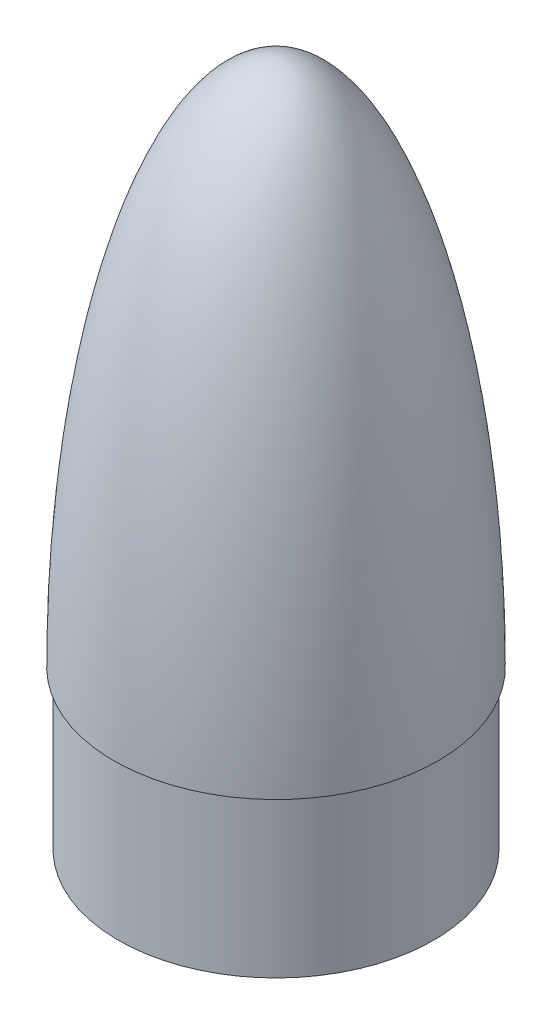
from build123d import *

# Parameters (mm, degrees)
SKETCH2_R           = 76.2
BOSS_EXTRUDE1_DEPTH = 76.2
SKETCH4_R           = 17.78
CUT_EXTRUDE1_DEPTH  = 96.52
CUT_EXTRUDE2_START  = 106.68
SKETCH5_R           = 8.255
CUT_EXTRUDE2_DEPTH  = 119.38
CUT_EXTRUDE3_START  = -25.4
SKETCH19_R          = 15.24
CUT_EXTRUDE3_DEPTH  = 101.6
SKETCH21_R          = 2.54
CUT_EXTRUDE4_DEPTH  = 6.35
SKETCH22_R          = 3
CUT_EXTRUDE5_DEPTH  = 12.7


with BuildPart() as part:
    # Sketch1 → Revolve1 (revolve)
    with BuildSketch(Plane.XY):
        with BuildLine():
            Line((78.359, 0), (0, 0))
            Line((0, 0), (0, 254))
            add(Edge.make_bspline(
                [(78.359, 0), (78.359, 0.547287489), (78.357845602, 1.649563618), (78.352650776, 3.586349875), (78.338796346, 5.988934597), (78.318010672, 8.352211569), (78.29028895, 10.745600888), (78.246958697, 13.731411826), (78.181061307, 17.311703382), (78.08386626, 21.490442467), (77.944822085, 26.264117007), (77.777683186, 31.037557631), (77.58229134, 35.809557456), (77.358460439, 40.580511863), (77.042853487, 46.542286246), (76.679080298, 52.501436144), (76.266448568, 58.457359127), (75.804102806, 64.409607399), (75.404015228, 69.168949637), (74.865626928, 75.114798701), (74.157385744, 82.243973993), (73.238266918, 90.551730955), (72.055740597, 100.030771811), (70.735528943, 109.491671534), (69.270929118, 118.931305028), (67.249996919, 130.699881306), (64.501732948, 144.763840427), (61.308555538, 158.735984092), (57.591049496, 172.577213574), (53.383025938, 186.275905479), (49.238746312, 198.044837449), (44.48323743, 209.587335711), (38.942884235, 220.71924179), (34.256173135, 228.693595393), (29.818710248, 235.095423042), (25.624249732, 240.182852143), (21.978892835, 243.926180276), (18.570150197, 246.859542723), (15.474349081, 249.076247661), (12.563405711, 250.785701438), (9.772327363, 252.083533871), (7.063069709, 253.028642362), (4.275373805, 253.686778481), (2.188006886, 253.939891173), (0.767171586, 253.999916555), (0, 254)],
                knots=[0.083290168, 0.083290168, 0.083290168, 0.083290168, 0.083290168, 0.091119674, 0.09894918, 0.106778686, 0.114608192, 0.122437698, 0.130267203, 0.145926215, 0.161585227, 0.177244239, 0.192903251, 0.208562263, 0.224221275, 0.239880287, 0.27119831, 0.286857322, 0.302516334, 0.318175346, 0.333834359, 0.365152383, 0.396470407, 0.42778843, 0.459106453, 0.490424474, 0.521742495, 0.584378539, 0.647014581, 0.678332609, 0.709650637, 0.772286631, 0.810589211, 0.841907031, 0.872607503, 0.893486158, 0.91262845, 0.928287274, 0.941044948, 0.952387223, 0.962498308, 0.97249612, 0.981348672, 0.989949856, 1, 1, 1, 1, 1], degree=4))
        make_face()
    revolve(axis=Axis((0, 254, 0), (0, -1, 0)))

    # Sketch2 → Boss-Extrude1 (add)
    with BuildSketch(Plane.XZ):
        Circle(SKETCH2_R)
    extrude(amount=BOSS_EXTRUDE1_DEPTH)

    # Sketch4 → Cut-Extrude1 (cut)
    with BuildSketch(Plane(origin=(0, 0, 0), x_dir=(1, 0, 0), z_dir=(0, 1, 0))):
        with Locations((48.26, 0)):
            Circle(SKETCH4_R)
        with Locations((0, -48.26)):
            Circle(SKETCH4_R)
        with Locations((-48.26, 0)):
            Circle(SKETCH4_R)
        with Locations((0, 48.26)):
            Circle(SKETCH4_R)
    extrude(amount=CUT_EXTRUDE1_DEPTH, mode=Mode.SUBTRACT)

    # Sketch5 → Cut-Extrude2 (cut)
    with BuildSketch(Plane(origin=(0, 0, 0), x_dir=(1, 0, 0), z_dir=(0, 1, 0)).offset(CUT_EXTRUDE2_START)):
        with Locations((20.32, 0)):
            Circle(SKETCH5_R)
        with Locations((10.16, -17.597636205)):
            Circle(SKETCH5_R)
        with Locations((-10.16, -17.597636205)):
            Circle(SKETCH5_R)
        with Locations((-20.32, 0)):
            Circle(SKETCH5_R)
        with Locations((-10.16, 17.597636205)):
            Circle(SKETCH5_R)
        with Locations((10.16, 17.597636205)):
            Circle(SKETCH5_R)
    extrude(amount=CUT_EXTRUDE2_DEPTH, mode=Mode.SUBTRACT)

    # Sketch6 → Cut-Revolve2 (revolve, cut)
    with BuildSketch(Plane.XY):
        Polygon((-30.48, 96.52), (-48.26, 117.709378876), (-48.26, 96.52), align=None)
    revolve(axis=Axis((-48.26, 96.52, 0), (0, -1, 0)), mode=Mode.SUBTRACT)

    # Sketch8 → Cut-Revolve4 (revolve, cut)
    with BuildSketch(Plane.XY.offset(48.26)):
        Polygon((0, 96.52), (17.78, 96.52), (0, 117.709378876), align=None)
    revolve(axis=Axis((0, 96.52, 48.26), (0, -1, 0)), mode=Mode.SUBTRACT)

    # Sketch9 → Cut-Revolve5 (revolve, cut)
    with BuildSketch(Plane.XY):
        Polygon((48.26, 96.52), (66.04, 96.52), (48.26, 117.709378876), align=None)
    revolve(axis=Axis((48.26, 96.52, 0), (0, -1, 0)), mode=Mode.SUBTRACT)

    # Sketch11 → Cut-Revolve6 (revolve, cut)
    with BuildSketch(Plane.XY.offset(-48.26)):
        Polygon((0, 96.52), (17.78, 96.52), (0, 117.709378876), align=None)
    revolve(axis=Axis((0, 96.52, -48.26), (0, -1, 0)), mode=Mode.SUBTRACT)

    # Sketch12 → Cut-Revolve7 (revolve, cut)
    with BuildSketch(Plane.XY):
        Polygon((-20.32, 226.06), (-12.065, 226.06), (-20.32, 235.897925907), align=None)
    revolve(axis=Axis((-20.32, 226.06, 0), (0, -1, 0)), mode=Mode.SUBTRACT)

    # Sketch14 → Cut-Revolve8 (revolve, cut)
    with BuildSketch(Plane.XY):
        Polygon((20.32, 226.06), (28.575, 226.06), (20.32, 235.897925907), align=None)
    revolve(axis=Axis((20.32, 235.897925907, 0), (0, -1, 0)), mode=Mode.SUBTRACT)

    # Sketch15 → Cut-Revolve9 (revolve, cut)
    with BuildSketch(Plane.XY.offset(17.597636205)):
        Polygon((-10.16, 226.06), (-1.905, 226.06), (-10.16, 235.897925907), align=None)
    revolve(axis=Axis((-10.16, 226.06, 17.597636205), (0, -1, 0)), mode=Mode.SUBTRACT)

    # Sketch16 → Cut-Revolve10 (revolve, cut)
    with BuildSketch(Plane.XY.offset(17.597636205)):
        Polygon((10.16, 226.06), (18.415, 226.06), (10.16, 235.897925907), align=None)
    revolve(axis=Axis((10.16, 235.897925907, 17.597636205), (0, -1, 0)), mode=Mode.SUBTRACT)

    # Sketch17 → Cut-Revolve11 (revolve, cut)
    with BuildSketch(Plane.XY.offset(-17.597636205)):
        Polygon((10.16, 226.06), (18.415, 226.06), (10.16, 235.897925907), align=None)
    revolve(axis=Axis((10.16, 235.897925907, -17.597636205), (0, -1, 0)), mode=Mode.SUBTRACT)

    # Sketch18 → Cut-Revolve12 (revolve, cut)
    with BuildSketch(Plane.XY.offset(-17.597636205)):
        Polygon((-10.16, 226.06), (-1.905, 226.06), (-10.16, 235.897925907), align=None)
    revolve(axis=Axis((-10.16, 235.897925907, -17.597636205), (0, -1, 0)), mode=Mode.SUBTRACT)

    # Sketch19 → Cut-Extrude3 (cut)
    with BuildSketch(Plane(origin=(0, 0, 0), x_dir=(1, 0, 0), z_dir=(0, 1, 0)).offset(CUT_EXTRUDE3_START)):
        Circle(SKETCH19_R)
    extrude(amount=CUT_EXTRUDE3_DEPTH, mode=Mode.SUBTRACT)

    # Sketch20 → Cut-Revolve13 (revolve, cut)
    with BuildSketch(Plane.XY):
        Polygon((0, 76.2), (15.24, 76.2), (0, 94.362324751), align=None)
    revolve(axis=Axis((0, 270.51, 0), (0, -1, 0)), mode=Mode.SUBTRACT)

    # Sketch21 → Cut-Extrude4 (cut)
    with BuildSketch(Plane.XZ.offset(76.2)):
        with Locations((-44.16298, 0)):
            Circle(SKETCH21_R)
        with Locations((0, 44.16298)):
            Circle(SKETCH21_R)
        with Locations((44.16298, 0)):
            Circle(SKETCH21_R)
        with Locations((0, -44.16298)):
            Circle(SKETCH21_R)
    extrude(amount=-CUT_EXTRUDE4_DEPTH, mode=Mode.SUBTRACT)

    # Sketch22 → Cut-Extrude5 (cut)
    with BuildSketch(Plane.XZ.offset(76.2)):
        with Locations((-35.921024484, -35.921024484)):
            Circle(SKETCH22_R)
        with Locations((-35.921024484, 35.921024484)):
            Circle(SKETCH22_R)
        with Locations((35.921024484, 35.921024484)):
            Circle(SKETCH22_R)
        with Locations((35.921024484, -35.921024484)):
            Circle(SKETCH22_R)
    extrude(amount=-CUT_EXTRUDE5_DEPTH, mode=Mode.SUBTRACT)

    # Sketch3 → Cut-Revolve1 (revolve, cut)
    with BuildSketch(Plane.XY):
        with BuildLine():
            Line((0, 0), (50.695639171, 0))
            ThreePointArc((50.695639171, 0), (37.521185782, 66.292890616), (0, 122.510985441))
            Line((0, 122.510985441), (0, 0))
        make_face()
    revolve(axis=Axis((0, 270.51, 0), (0, -1, 0)), mode=Mode.SUBTRACT)


solid = part.part
